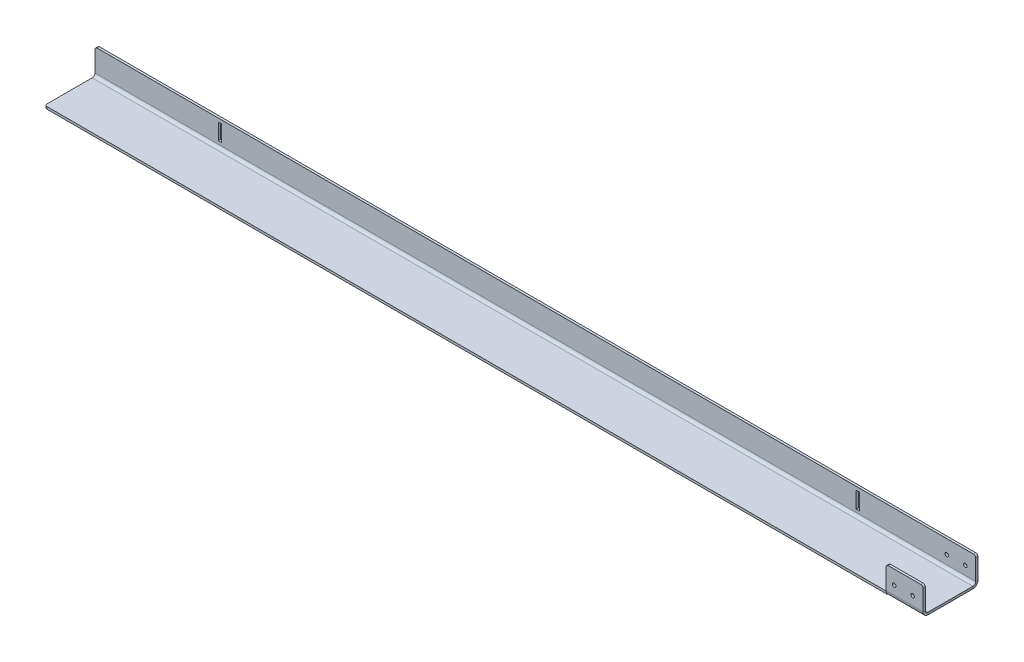
from build123d import *

# Parameters (mm, degrees)
SKETCH1_W                     = 1209.675
SKETCH1_H                     = 72.3138
BASE_FLANGE1_DEPTH            = 3.175
EDGE_FLANGE1_STRIP_W          = 20.32
EDGE_FLANGE1_STRIP_H          = 3.175
EDGE_FLANGE1_STRIP_CUT_DEPTH  = 1209.675
EDGE_FLANGE1_DEPTH            = 1209.675
SKETCH10_W                    = 4.191
SKETCH10_H                    = 22.225
CUT_EXTRUDE2_DEPTH            = 611.335397201
FILLET1_R                     = 3.175
LPATTERN1_COUNT               = 2
LPATTERN1_PITCH               = 876.173
EDGE_FLANGE2_STRIP_W          = 20.32
EDGE_FLANGE2_STRIP_H          = 3.175
EDGE_FLANGE2_STRIP_CUT_DEPTH  = 50.8
EDGE_FLANGE2_RELIEF_W         = 21.9075
EDGE_FLANGE2_RELIEF_H         = 1.5875
EDGE_FLANGE2_RELIEF_CUT_DEPTH = 3.175
EDGE_FLANGE2_DEPTH            = 50.8
FILLET2_R                     = 3.175
F_10_0_1935_DIAMETER_HOLE1_D  = 4.9149


# Sheet-metal steps are written as plain solids
with BuildPart() as part:
    # Sketch1 → Base-Flange1 (new body)
    with BuildSketch(Plane(origin=(0, 0, 0), x_dir=(1, 0, 0), z_dir=(0, 1, 0))):
        with Locations((0, -36.1569)):
            Rectangle(SKETCH1_W, SKETCH1_H)
    extrude(amount=BASE_FLANGE1_DEPTH)

    # Edge-Flange1 strip (across the edge) → Edge-Flange1 strip cut (cut)
    with BuildSketch(Plane(origin=(604.8375, 3.175, 0), x_dir=(0, 0, 1), z_dir=(-1, 0, 0))):
        with Locations((-3.175, -1.5875)):
            Rectangle(EDGE_FLANGE1_STRIP_W, EDGE_FLANGE1_STRIP_H)
    extrude(amount=EDGE_FLANGE1_STRIP_CUT_DEPTH, mode=Mode.SUBTRACT)

    # Edge-Flange1 section (across the edge) → Edge-Flange1 (add)
    with BuildSketch(Plane(origin=(604.8375, 3.175, 0), x_dir=(0, 0, 1), z_dir=(-1, 0, 0))):
        with BuildLine():
            Line((0, 3.81), (0, 34.925))
            Line((0, 34.925), (3.175, 34.925))
            Line((3.175, 34.925), (3.175, 3.81))
            ThreePointArc((3.175, 3.81), (4.290923164, 1.115923164), (6.985, 0))
            Line((6.985, 0), (6.985, -3.175))
            ThreePointArc((6.985, -3.175), (2.045859133, -1.129140867), (0, 3.81))
        make_face()
    extrude(amount=EDGE_FLANGE1_DEPTH)

    # Sketch10 → Cut-Extrude2 (cut, through all)
    with BuildSketch(Plane(origin=(0, 0, 0), x_dir=(-1, 0, 0), z_dir=(0, 0, -1))):
        with Locations((433.324, 22.225)):
            Rectangle(SKETCH10_W, SKETCH10_H)
    cut_extrude2 = extrude(amount=-CUT_EXTRUDE2_DEPTH, mode=Mode.SUBTRACT)

    # Fillet1
    fillet1_edges = [part.edges().sort_by_distance(p)[0] for p in [
        (604.8375, 38.1, 1.5875),
        (-604.8375, 38.1, 1.5875),
        (-604.8375, 1.5875, 72.3138),
    ]]
    fillet(fillet1_edges, radius=FILLET1_R)

    # LPattern1: Cut-Extrude2 ×2
    with Locations(*[(i * LPATTERN1_PITCH, 0, 0) for i in range(1, LPATTERN1_COUNT)]):
        add(cut_extrude2, mode=Mode.SUBTRACT)

    # Edge-Flange2 strip (across the edge) → Edge-Flange2 strip cut (cut)
    with BuildSketch(Plane(origin=(554.0375, 3.175, 72.3138), x_dir=(0, 0, -1), z_dir=(1, 0, 0))):
        with Locations((-6.35, -1.5875)):
            Rectangle(EDGE_FLANGE2_STRIP_W, EDGE_FLANGE2_STRIP_H)
    extrude(amount=EDGE_FLANGE2_STRIP_CUT_DEPTH, mode=Mode.SUBTRACT)

    # Edge-Flange2 relief (on the sheet) → Edge-Flange2 relief cut (cut)
    with BuildSketch(Plane(origin=(554.0375, 3.175, 68.5038), x_dir=(0, 0, -1), z_dir=(0, 1, 0))):
        with Locations((-9.36625, 0.79375)):
            Rectangle(EDGE_FLANGE2_RELIEF_W, EDGE_FLANGE2_RELIEF_H)
    extrude(amount=-EDGE_FLANGE2_RELIEF_CUT_DEPTH, mode=Mode.SUBTRACT)

    # Edge-Flange2 section (across the edge) → Edge-Flange2 (add)
    with BuildSketch(Plane(origin=(554.0375, 3.175, 72.3138), x_dir=(0, 0, -1), z_dir=(1, 0, 0))):
        with BuildLine():
            Line((-3.175, 3.81), (-3.175, 34.925))
            Line((-3.175, 34.925), (0, 34.925))
            Line((0, 34.925), (0, 3.81))
            ThreePointArc((0, 3.81), (1.115923164, 1.115923164), (3.81, 0))
            Line((3.81, 0), (3.81, -3.175))
            ThreePointArc((3.81, -3.175), (-1.129140867, -1.129140867), (-3.175, 3.81))
        make_face()
    extrude(amount=EDGE_FLANGE2_DEPTH)

    # Fillet2
    fillet2_edges = [part.edges().sort_by_distance(p)[0] for p in [
        (554.0375, 38.1, 73.9013),
        (604.8375, 38.1, 73.9013),
    ]]
    fillet(fillet2_edges, radius=FILLET2_R)

    # #10 (0.1935) Diameter Hole1 (through all)
    with Locations(Plane.XY.offset(75.4888)):
        with Locations((590.55, 19.05), (565.15, 19.05)):
            Hole(F_10_0_1935_DIAMETER_HOLE1_D / 2)


solid = part.part
